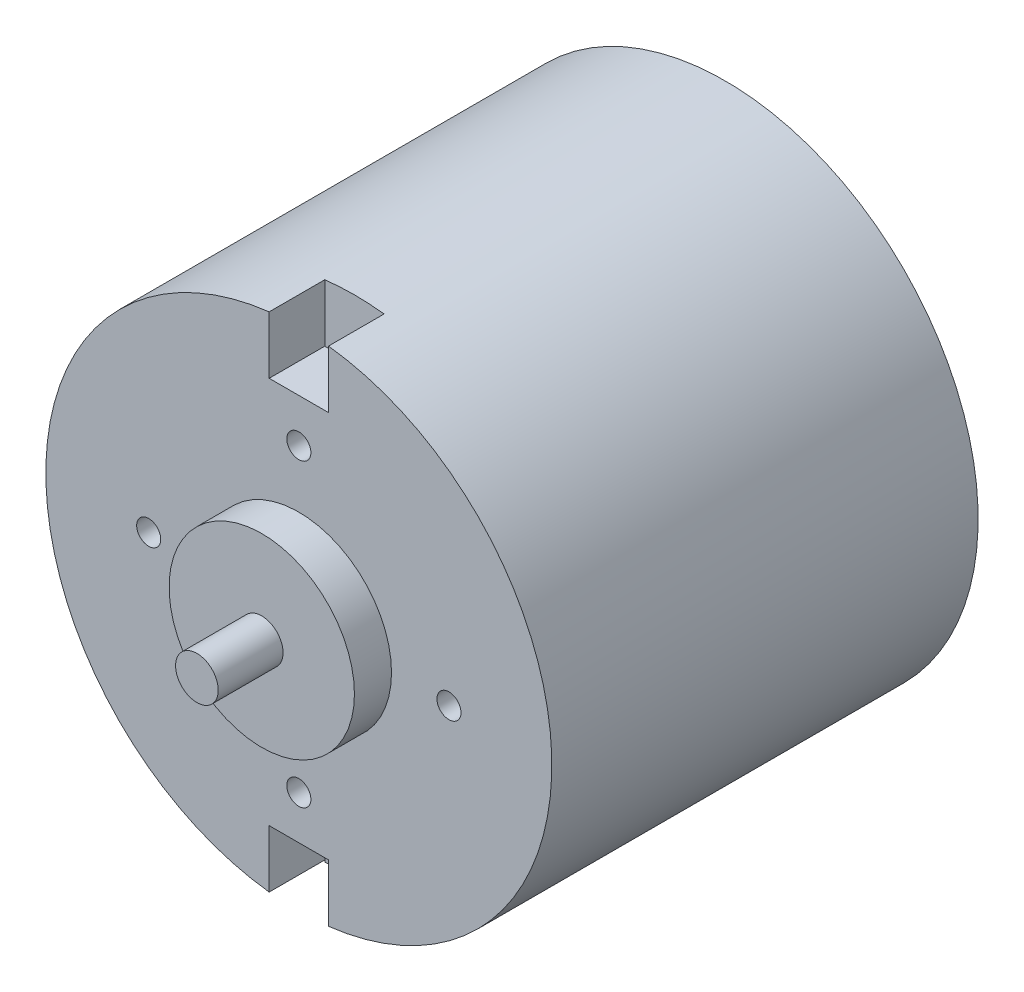
from build123d import *

# Parameters (mm, degrees)
SKETCH1_R           = 0.65
BOSS_EXTRUDE1_DEPTH = 3
BOSS_EXTRUDE2_START = -20
BOSS_EXTRUDE2_DEPTH = 20
SKETCH1_4_R         = 5
SKETCH1_4_R_2       = 1.15
BOSS_EXTRUDE3_DEPTH = 5
SKETCH1_5_R         = 1.15
BOSS_EXTRUDE4_DEPTH = 8.5


with BuildPart() as part:
    # Sketch1 → Boss-Extrude1 (new body)
    with BuildSketch(Plane.XY):
        with BuildLine():
            Line((-1.6, 10.45), (-1.6, 13.555902773))
            ThreePointArc((-1.6, 13.555902773), (-13.65, 0), (-1.6, -13.555902773))
            Line((-1.6, -13.555902773), (-1.6, -10.45))
            Line((-1.6, -10.45), (1.6, -10.45))
            Line((1.6, -10.45), (1.6, -13.555902773))
            ThreePointArc((1.6, -13.555902773), (13.65, 0), (1.6, 13.555902773))
            Line((1.6, 13.555902773), (1.6, 10.45))
            Line((1.6, 10.45), (-1.6, 10.45))
        make_face()
        with Locations((0, -8.1)):
            Circle(SKETCH1_R, mode=Mode.SUBTRACT)
        with Locations((-8.1, 0)):
            Circle(SKETCH1_R, mode=Mode.SUBTRACT)
        with Locations((8.1, 0)):
            Circle(SKETCH1_R, mode=Mode.SUBTRACT)
        with Locations((0, 8.1)):
            Circle(SKETCH1_R, mode=Mode.SUBTRACT)
    extrude(amount=BOSS_EXTRUDE1_DEPTH)

    # Sketch1<3> → Boss-Extrude2 (add)
    with BuildSketch(Plane.XY.offset(BOSS_EXTRUDE2_START)):
        with BuildLine():
            Line((-1.6, -13.555902773), (-1.6, -13.65))
            Line((-1.6, -13.65), (1.6, -13.65))
            Line((1.6, -13.65), (1.6, -13.555902773))
            ThreePointArc((1.6, -13.555902773), (0, 13.65), (-1.6, -13.555902773))
        make_face()
    extrude(amount=BOSS_EXTRUDE2_DEPTH)

    # Sketch1<4> → Boss-Extrude3 (add)
    with BuildSketch(Plane.XY):
        Circle(SKETCH1_4_R)
        Circle(SKETCH1_4_R_2, mode=Mode.SUBTRACT)
    extrude(amount=BOSS_EXTRUDE3_DEPTH)

    # Sketch1<5> → Boss-Extrude4 (add)
    with BuildSketch(Plane.XY):
        Circle(SKETCH1_5_R)
    extrude(amount=BOSS_EXTRUDE4_DEPTH)


solid = part.part
